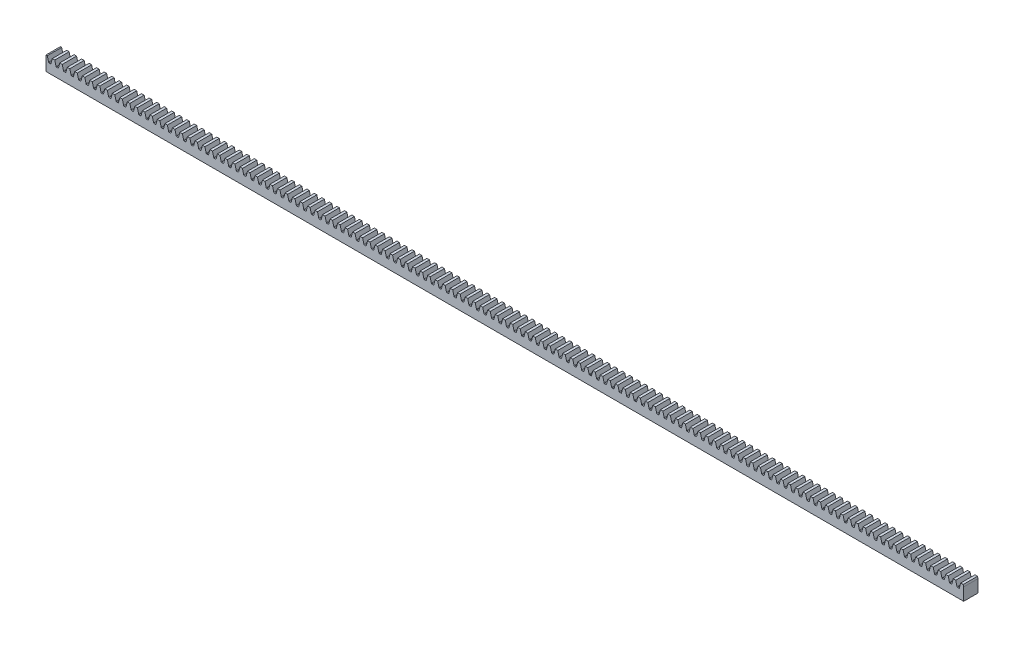
from build123d import *

# Parameters (mm, degrees)
SKETCH1_W           = 304.8
SKETCH1_H           = 4.7625
BOSS_EXTRUDE1_DEPTH = 2.38125
CUT_EXTRUDE1_DEPTH  = 4.7625
FILLET3_R           = 0.181970114
LPATTERN4_START     = -2.38125
LPATTERN4_DEPTH     = 4.7625


# Read off the part's stored shape, not the designer's step: LPattern4
with BuildPart() as part:
    # Sketch1 → Boss-Extrude1 (new, symmetric)
    with BuildSketch(Plane.XY):
        Rectangle(SKETCH1_W, SKETCH1_H)
    extrude(amount=BOSS_EXTRUDE1_DEPTH, both=True)

    # Sketch2 → Cut-Extrude1 (cut)
    with BuildSketch(Plane.XY.offset(2.38125)):
        Polygon((-151.981866458, 2.38125), (-151.517117728, 0.5842), (-150.789237272, 0.5842), (-150.324488542, 2.38125), align=None)
    extrude(amount=-CUT_EXTRUDE1_DEPTH, mode=Mode.SUBTRACT)

    # Fillet3
    fillet3_edges = [part.edges().sort_by_distance(p)[0] for p in [
        (-150.789237272, 0.5842, 0),
        (-151.517117728, 0.5842, 0),
    ]]
    fillet(fillet3_edges, radius=FILLET3_R)

    # LPattern4 outline → LPattern4 (cut)
    with BuildSketch(Plane.XY.offset(LPATTERN4_START)):
        with BuildLine():
            ThreePointArc((-149.058750348, 0.720608436), (-148.99398166, 0.622288242), (-148.882576412, 0.5842))
            Line((-148.882576412, 0.5842), (-148.436488588, 0.5842))
            ThreePointArc((-148.436488588, 0.5842), (-148.32508334, 0.622288242), (-148.260314652, 0.720608436))
            Line((-148.260314652, 0.720608436), (-147.830843542, 2.38125))
            Line((-147.830843542, 2.38125), (-149.488221458, 2.38125))
            Line((-149.488221458, 2.38125), (-149.058750348, 0.720608436))
        make_face()
        Polygon((152.4, 2.38125), (152.242823542, 2.38125), (152.4, 1.773493733), align=None)
        with BuildLine():
            Line((151.406556458, 2.38125), (149.749178542, 2.38125))
            Line((149.749178542, 2.38125), (150.178649652, 0.720608436))
            ThreePointArc((150.178649652, 0.720608436), (150.24341834, 0.622288242), (150.354823588, 0.5842))
            Line((150.354823588, 0.5842), (150.800911412, 0.5842))
            ThreePointArc((150.800911412, 0.5842), (150.91231666, 0.622288242), (150.977085348, 0.720608436))
            Line((150.977085348, 0.720608436), (151.406556458, 2.38125))
        make_face()
        with BuildLine():
            Line((148.912911458, 2.38125), (147.255533542, 2.38125))
            Line((147.255533542, 2.38125), (147.685004652, 0.720608436))
            ThreePointArc((147.685004652, 0.720608436), (147.74977334, 0.622288242), (147.861178588, 0.5842))
            Line((147.861178588, 0.5842), (148.307266412, 0.5842))
            ThreePointArc((148.307266412, 0.5842), (148.41867166, 0.622288242), (148.483440348, 0.720608436))
            Line((148.483440348, 0.720608436), (148.912911458, 2.38125))
        make_face()
        with BuildLine():
            Line((146.419266458, 2.38125), (144.761888542, 2.38125))
            Line((144.761888542, 2.38125), (145.191359652, 0.720608436))
            ThreePointArc((145.191359652, 0.720608436), (145.25612834, 0.622288242), (145.367533588, 0.5842))
            Line((145.367533588, 0.5842), (145.813621412, 0.5842))
            ThreePointArc((145.813621412, 0.5842), (145.92502666, 0.622288242), (145.989795348, 0.720608436))
            Line((145.989795348, 0.720608436), (146.419266458, 2.38125))
        make_face()
        with BuildLine():
            Line((143.925621458, 2.38125), (142.268243542, 2.38125))
            Line((142.268243542, 2.38125), (142.697714652, 0.720608436))
            ThreePointArc((142.697714652, 0.720608436), (142.76248334, 0.622288242), (142.873888588, 0.5842))
            Line((142.873888588, 0.5842), (143.319976412, 0.5842))
            ThreePointArc((143.319976412, 0.5842), (143.43138166, 0.622288242), (143.496150348, 0.720608436))
            Line((143.496150348, 0.720608436), (143.925621458, 2.38125))
        make_face()
        with BuildLine():
            Line((141.431976458, 2.38125), (139.774598542, 2.38125))
            Line((139.774598542, 2.38125), (140.204069652, 0.720608436))
            ThreePointArc((140.204069652, 0.720608436), (140.26883834, 0.622288242), (140.380243588, 0.5842))
            Line((140.380243588, 0.5842), (140.826331412, 0.5842))
            ThreePointArc((140.826331412, 0.5842), (140.93773666, 0.622288242), (141.002505348, 0.720608436))
            Line((141.002505348, 0.720608436), (141.431976458, 2.38125))
        make_face()
        with BuildLine():
            Line((138.938331458, 2.38125), (137.280953542, 2.38125))
            Line((137.280953542, 2.38125), (137.710424652, 0.720608436))
            ThreePointArc((137.710424652, 0.720608436), (137.77519334, 0.622288242), (137.886598588, 0.5842))
            Line((137.886598588, 0.5842), (138.332686412, 0.5842))
            ThreePointArc((138.332686412, 0.5842), (138.44409166, 0.622288242), (138.508860348, 0.720608436))
            Line((138.508860348, 0.720608436), (138.938331458, 2.38125))
        make_face()
        with BuildLine():
            Line((136.444686458, 2.38125), (134.787308542, 2.38125))
            Line((134.787308542, 2.38125), (135.216779652, 0.720608436))
            ThreePointArc((135.216779652, 0.720608436), (135.28154834, 0.622288242), (135.392953588, 0.5842))
            Line((135.392953588, 0.5842), (135.839041412, 0.5842))
            ThreePointArc((135.839041412, 0.5842), (135.95044666, 0.622288242), (136.015215348, 0.720608436))
            Line((136.015215348, 0.720608436), (136.444686458, 2.38125))
        make_face()
        with BuildLine():
            Line((133.951041458, 2.38125), (132.293663542, 2.38125))
            Line((132.293663542, 2.38125), (132.723134652, 0.720608436))
            ThreePointArc((132.723134652, 0.720608436), (132.78790334, 0.622288242), (132.899308588, 0.5842))
            Line((132.899308588, 0.5842), (133.345396412, 0.5842))
            ThreePointArc((133.345396412, 0.5842), (133.45680166, 0.622288242), (133.521570348, 0.720608436))
            Line((133.521570348, 0.720608436), (133.951041458, 2.38125))
        make_face()
        with BuildLine():
            Line((131.457396458, 2.38125), (129.800018542, 2.38125))
            Line((129.800018542, 2.38125), (130.229489652, 0.720608436))
            ThreePointArc((130.229489652, 0.720608436), (130.29425834, 0.622288242), (130.405663588, 0.5842))
            Line((130.405663588, 0.5842), (130.851751412, 0.5842))
            ThreePointArc((130.851751412, 0.5842), (130.96315666, 0.622288242), (131.027925348, 0.720608436))
            Line((131.027925348, 0.720608436), (131.457396458, 2.38125))
        make_face()
        with BuildLine():
            Line((128.963751458, 2.38125), (127.306373542, 2.38125))
            Line((127.306373542, 2.38125), (127.735844652, 0.720608436))
            ThreePointArc((127.735844652, 0.720608436), (127.80061334, 0.622288242), (127.912018588, 0.5842))
            Line((127.912018588, 0.5842), (128.358106412, 0.5842))
            ThreePointArc((128.358106412, 0.5842), (128.46951166, 0.622288242), (128.534280348, 0.720608436))
            Line((128.534280348, 0.720608436), (128.963751458, 2.38125))
        make_face()
        with BuildLine():
            Line((126.470106458, 2.38125), (124.812728542, 2.38125))
            Line((124.812728542, 2.38125), (125.242199652, 0.720608436))
            ThreePointArc((125.242199652, 0.720608436), (125.30696834, 0.622288242), (125.418373588, 0.5842))
            Line((125.418373588, 0.5842), (125.864461412, 0.5842))
            ThreePointArc((125.864461412, 0.5842), (125.97586666, 0.622288242), (126.040635348, 0.720608436))
            Line((126.040635348, 0.720608436), (126.470106458, 2.38125))
        make_face()
        with BuildLine():
            Line((123.976461458, 2.38125), (122.319083542, 2.38125))
            Line((122.319083542, 2.38125), (122.748554652, 0.720608436))
            ThreePointArc((122.748554652, 0.720608436), (122.81332334, 0.622288242), (122.924728588, 0.5842))
            Line((122.924728588, 0.5842), (123.370816412, 0.5842))
            ThreePointArc((123.370816412, 0.5842), (123.48222166, 0.622288242), (123.546990348, 0.720608436))
            Line((123.546990348, 0.720608436), (123.976461458, 2.38125))
        make_face()
        with BuildLine():
            Line((121.482816458, 2.38125), (119.825438542, 2.38125))
            Line((119.825438542, 2.38125), (120.254909652, 0.720608436))
            ThreePointArc((120.254909652, 0.720608436), (120.31967834, 0.622288242), (120.431083588, 0.5842))
            Line((120.431083588, 0.5842), (120.877171412, 0.5842))
            ThreePointArc((120.877171412, 0.5842), (120.98857666, 0.622288242), (121.053345348, 0.720608436))
            Line((121.053345348, 0.720608436), (121.482816458, 2.38125))
        make_face()
        with BuildLine():
            Line((118.989171458, 2.38125), (117.331793542, 2.38125))
            Line((117.331793542, 2.38125), (117.761264652, 0.720608436))
            ThreePointArc((117.761264652, 0.720608436), (117.82603334, 0.622288242), (117.937438588, 0.5842))
            Line((117.937438588, 0.5842), (118.383526412, 0.5842))
            ThreePointArc((118.383526412, 0.5842), (118.49493166, 0.622288242), (118.559700348, 0.720608436))
            Line((118.559700348, 0.720608436), (118.989171458, 2.38125))
        make_face()
        with BuildLine():
            Line((116.495526458, 2.38125), (114.838148542, 2.38125))
            Line((114.838148542, 2.38125), (115.267619652, 0.720608436))
            ThreePointArc((115.267619652, 0.720608436), (115.33238834, 0.622288242), (115.443793588, 0.5842))
            Line((115.443793588, 0.5842), (115.889881412, 0.5842))
            ThreePointArc((115.889881412, 0.5842), (116.00128666, 0.622288242), (116.066055348, 0.720608436))
            Line((116.066055348, 0.720608436), (116.495526458, 2.38125))
        make_face()
        with BuildLine():
            Line((114.001881458, 2.38125), (112.344503542, 2.38125))
            Line((112.344503542, 2.38125), (112.773974652, 0.720608436))
            ThreePointArc((112.773974652, 0.720608436), (112.83874334, 0.622288242), (112.950148588, 0.5842))
            Line((112.950148588, 0.5842), (113.396236412, 0.5842))
            ThreePointArc((113.396236412, 0.5842), (113.50764166, 0.622288242), (113.572410348, 0.720608436))
            Line((113.572410348, 0.720608436), (114.001881458, 2.38125))
        make_face()
        with BuildLine():
            Line((111.508236458, 2.38125), (109.850858542, 2.38125))
            Line((109.850858542, 2.38125), (110.280329652, 0.720608436))
            ThreePointArc((110.280329652, 0.720608436), (110.34509834, 0.622288242), (110.456503588, 0.5842))
            Line((110.456503588, 0.5842), (110.902591412, 0.5842))
            ThreePointArc((110.902591412, 0.5842), (111.01399666, 0.622288242), (111.078765348, 0.720608436))
            Line((111.078765348, 0.720608436), (111.508236458, 2.38125))
        make_face()
        with BuildLine():
            Line((109.014591458, 2.38125), (107.357213542, 2.38125))
            Line((107.357213542, 2.38125), (107.786684652, 0.720608436))
            ThreePointArc((107.786684652, 0.720608436), (107.85145334, 0.622288242), (107.962858588, 0.5842))
            Line((107.962858588, 0.5842), (108.408946412, 0.5842))
            ThreePointArc((108.408946412, 0.5842), (108.52035166, 0.622288242), (108.585120348, 0.720608436))
            Line((108.585120348, 0.720608436), (109.014591458, 2.38125))
        make_face()
        with BuildLine():
            Line((106.520946458, 2.38125), (104.863568542, 2.38125))
            Line((104.863568542, 2.38125), (105.293039652, 0.720608436))
            ThreePointArc((105.293039652, 0.720608436), (105.35780834, 0.622288242), (105.469213588, 0.5842))
            Line((105.469213588, 0.5842), (105.915301412, 0.5842))
            ThreePointArc((105.915301412, 0.5842), (106.02670666, 0.622288242), (106.091475348, 0.720608436))
            Line((106.091475348, 0.720608436), (106.520946458, 2.38125))
        make_face()
        with BuildLine():
            Line((104.027301458, 2.38125), (102.369923542, 2.38125))
            Line((102.369923542, 2.38125), (102.799394652, 0.720608436))
            ThreePointArc((102.799394652, 0.720608436), (102.86416334, 0.622288242), (102.975568588, 0.5842))
            Line((102.975568588, 0.5842), (103.421656412, 0.5842))
            ThreePointArc((103.421656412, 0.5842), (103.53306166, 0.622288242), (103.597830348, 0.720608436))
            Line((103.597830348, 0.720608436), (104.027301458, 2.38125))
        make_face()
        with BuildLine():
            Line((101.533656458, 2.38125), (99.876278542, 2.38125))
            Line((99.876278542, 2.38125), (100.305749652, 0.720608436))
            ThreePointArc((100.305749652, 0.720608436), (100.37051834, 0.622288242), (100.481923588, 0.5842))
            Line((100.481923588, 0.5842), (100.928011412, 0.5842))
            ThreePointArc((100.928011412, 0.5842), (101.03941666, 0.622288242), (101.104185348, 0.720608436))
            Line((101.104185348, 0.720608436), (101.533656458, 2.38125))
        make_face()
        with BuildLine():
            Line((99.040011458, 2.38125), (97.382633542, 2.38125))
            Line((97.382633542, 2.38125), (97.812104652, 0.720608436))
            ThreePointArc((97.812104652, 0.720608436), (97.87687334, 0.622288242), (97.988278588, 0.5842))
            Line((97.988278588, 0.5842), (98.434366412, 0.5842))
            ThreePointArc((98.434366412, 0.5842), (98.54577166, 0.622288242), (98.610540348, 0.720608436))
            Line((98.610540348, 0.720608436), (99.040011458, 2.38125))
        make_face()
        with BuildLine():
            Line((96.546366458, 2.38125), (94.888988542, 2.38125))
            Line((94.888988542, 2.38125), (95.318459652, 0.720608436))
            ThreePointArc((95.318459652, 0.720608436), (95.38322834, 0.622288242), (95.494633588, 0.5842))
            Line((95.494633588, 0.5842), (95.940721412, 0.5842))
            ThreePointArc((95.940721412, 0.5842), (96.05212666, 0.622288242), (96.116895348, 0.720608436))
            Line((96.116895348, 0.720608436), (96.546366458, 2.38125))
        make_face()
        with BuildLine():
            Line((94.052721458, 2.38125), (92.395343542, 2.38125))
            Line((92.395343542, 2.38125), (92.824814652, 0.720608436))
            ThreePointArc((92.824814652, 0.720608436), (92.88958334, 0.622288242), (93.000988588, 0.5842))
            Line((93.000988588, 0.5842), (93.447076412, 0.5842))
            ThreePointArc((93.447076412, 0.5842), (93.55848166, 0.622288242), (93.623250348, 0.720608436))
            Line((93.623250348, 0.720608436), (94.052721458, 2.38125))
        make_face()
        with BuildLine():
            Line((91.559076458, 2.38125), (89.901698542, 2.38125))
            Line((89.901698542, 2.38125), (90.331169652, 0.720608436))
            ThreePointArc((90.331169652, 0.720608436), (90.39593834, 0.622288242), (90.507343588, 0.5842))
            Line((90.507343588, 0.5842), (90.953431412, 0.5842))
            ThreePointArc((90.953431412, 0.5842), (91.06483666, 0.622288242), (91.129605348, 0.720608436))
            Line((91.129605348, 0.720608436), (91.559076458, 2.38125))
        make_face()
        with BuildLine():
            Line((89.065431458, 2.38125), (87.408053542, 2.38125))
            Line((87.408053542, 2.38125), (87.837524652, 0.720608436))
            ThreePointArc((87.837524652, 0.720608436), (87.90229334, 0.622288242), (88.013698588, 0.5842))
            Line((88.013698588, 0.5842), (88.459786412, 0.5842))
            ThreePointArc((88.459786412, 0.5842), (88.57119166, 0.622288242), (88.635960348, 0.720608436))
            Line((88.635960348, 0.720608436), (89.065431458, 2.38125))
        make_face()
        with BuildLine():
            Line((86.571786458, 2.38125), (84.914408542, 2.38125))
            Line((84.914408542, 2.38125), (85.343879652, 0.720608436))
            ThreePointArc((85.343879652, 0.720608436), (85.40864834, 0.622288242), (85.520053588, 0.5842))
            Line((85.520053588, 0.5842), (85.966141412, 0.5842))
            ThreePointArc((85.966141412, 0.5842), (86.07754666, 0.622288242), (86.142315348, 0.720608436))
            Line((86.142315348, 0.720608436), (86.571786458, 2.38125))
        make_face()
        with BuildLine():
            Line((84.078141458, 2.38125), (82.420763542, 2.38125))
            Line((82.420763542, 2.38125), (82.850234652, 0.720608436))
            ThreePointArc((82.850234652, 0.720608436), (82.91500334, 0.622288242), (83.026408588, 0.5842))
            Line((83.026408588, 0.5842), (83.472496412, 0.5842))
            ThreePointArc((83.472496412, 0.5842), (83.58390166, 0.622288242), (83.648670348, 0.720608436))
            Line((83.648670348, 0.720608436), (84.078141458, 2.38125))
        make_face()
        with BuildLine():
            Line((81.584496458, 2.38125), (79.927118542, 2.38125))
            Line((79.927118542, 2.38125), (80.356589652, 0.720608436))
            ThreePointArc((80.356589652, 0.720608436), (80.42135834, 0.622288242), (80.532763588, 0.5842))
            Line((80.532763588, 0.5842), (80.978851412, 0.5842))
            ThreePointArc((80.978851412, 0.5842), (81.09025666, 0.622288242), (81.155025348, 0.720608436))
            Line((81.155025348, 0.720608436), (81.584496458, 2.38125))
        make_face()
        with BuildLine():
            Line((79.090851458, 2.38125), (77.433473542, 2.38125))
            Line((77.433473542, 2.38125), (77.862944652, 0.720608436))
            ThreePointArc((77.862944652, 0.720608436), (77.92771334, 0.622288242), (78.039118588, 0.5842))
            Line((78.039118588, 0.5842), (78.485206412, 0.5842))
            ThreePointArc((78.485206412, 0.5842), (78.59661166, 0.622288242), (78.661380348, 0.720608436))
            Line((78.661380348, 0.720608436), (79.090851458, 2.38125))
        make_face()
        with BuildLine():
            Line((76.597206458, 2.38125), (74.939828542, 2.38125))
            Line((74.939828542, 2.38125), (75.369299652, 0.720608436))
            ThreePointArc((75.369299652, 0.720608436), (75.43406834, 0.622288242), (75.545473588, 0.5842))
            Line((75.545473588, 0.5842), (75.991561412, 0.5842))
            ThreePointArc((75.991561412, 0.5842), (76.10296666, 0.622288242), (76.167735348, 0.720608436))
            Line((76.167735348, 0.720608436), (76.597206458, 2.38125))
        make_face()
        with BuildLine():
            Line((74.103561458, 2.38125), (72.446183542, 2.38125))
            Line((72.446183542, 2.38125), (72.875654652, 0.720608436))
            ThreePointArc((72.875654652, 0.720608436), (72.94042334, 0.622288242), (73.051828588, 0.5842))
            Line((73.051828588, 0.5842), (73.497916412, 0.5842))
            ThreePointArc((73.497916412, 0.5842), (73.60932166, 0.622288242), (73.674090348, 0.720608436))
            Line((73.674090348, 0.720608436), (74.103561458, 2.38125))
        make_face()
        with BuildLine():
            Line((71.609916458, 2.38125), (69.952538542, 2.38125))
            Line((69.952538542, 2.38125), (70.382009652, 0.720608436))
            ThreePointArc((70.382009652, 0.720608436), (70.44677834, 0.622288242), (70.558183588, 0.5842))
            Line((70.558183588, 0.5842), (71.004271412, 0.5842))
            ThreePointArc((71.004271412, 0.5842), (71.11567666, 0.622288242), (71.180445348, 0.720608436))
            Line((71.180445348, 0.720608436), (71.609916458, 2.38125))
        make_face()
        with BuildLine():
            Line((69.116271458, 2.38125), (67.458893542, 2.38125))
            Line((67.458893542, 2.38125), (67.888364652, 0.720608436))
            ThreePointArc((67.888364652, 0.720608436), (67.95313334, 0.622288242), (68.064538588, 0.5842))
            Line((68.064538588, 0.5842), (68.510626412, 0.5842))
            ThreePointArc((68.510626412, 0.5842), (68.62203166, 0.622288242), (68.686800348, 0.720608436))
            Line((68.686800348, 0.720608436), (69.116271458, 2.38125))
        make_face()
        with BuildLine():
            Line((66.622626458, 2.38125), (64.965248542, 2.38125))
            Line((64.965248542, 2.38125), (65.394719652, 0.720608436))
            ThreePointArc((65.394719652, 0.720608436), (65.45948834, 0.622288242), (65.570893588, 0.5842))
            Line((65.570893588, 0.5842), (66.016981412, 0.5842))
            ThreePointArc((66.016981412, 0.5842), (66.12838666, 0.622288242), (66.193155348, 0.720608436))
            Line((66.193155348, 0.720608436), (66.622626458, 2.38125))
        make_face()
        with BuildLine():
            Line((64.128981458, 2.38125), (62.471603542, 2.38125))
            Line((62.471603542, 2.38125), (62.901074652, 0.720608436))
            ThreePointArc((62.901074652, 0.720608436), (62.96584334, 0.622288242), (63.077248588, 0.5842))
            Line((63.077248588, 0.5842), (63.523336412, 0.5842))
            ThreePointArc((63.523336412, 0.5842), (63.63474166, 0.622288242), (63.699510348, 0.720608436))
            Line((63.699510348, 0.720608436), (64.128981458, 2.38125))
        make_face()
        with BuildLine():
            Line((61.635336458, 2.38125), (59.977958542, 2.38125))
            Line((59.977958542, 2.38125), (60.407429652, 0.720608436))
            ThreePointArc((60.407429652, 0.720608436), (60.47219834, 0.622288242), (60.583603588, 0.5842))
            Line((60.583603588, 0.5842), (61.029691412, 0.5842))
            ThreePointArc((61.029691412, 0.5842), (61.14109666, 0.622288242), (61.205865348, 0.720608436))
            Line((61.205865348, 0.720608436), (61.635336458, 2.38125))
        make_face()
        with BuildLine():
            Line((59.141691458, 2.38125), (57.484313542, 2.38125))
            Line((57.484313542, 2.38125), (57.913784652, 0.720608436))
            ThreePointArc((57.913784652, 0.720608436), (57.97855334, 0.622288242), (58.089958588, 0.5842))
            Line((58.089958588, 0.5842), (58.536046412, 0.5842))
            ThreePointArc((58.536046412, 0.5842), (58.64745166, 0.622288242), (58.712220348, 0.720608436))
            Line((58.712220348, 0.720608436), (59.141691458, 2.38125))
        make_face()
        with BuildLine():
            Line((56.648046458, 2.38125), (54.990668542, 2.38125))
            Line((54.990668542, 2.38125), (55.420139652, 0.720608436))
            ThreePointArc((55.420139652, 0.720608436), (55.48490834, 0.622288242), (55.596313588, 0.5842))
            Line((55.596313588, 0.5842), (56.042401412, 0.5842))
            ThreePointArc((56.042401412, 0.5842), (56.15380666, 0.622288242), (56.218575348, 0.720608436))
            Line((56.218575348, 0.720608436), (56.648046458, 2.38125))
        make_face()
        with BuildLine():
            Line((54.154401458, 2.38125), (52.497023542, 2.38125))
            Line((52.497023542, 2.38125), (52.926494652, 0.720608436))
            ThreePointArc((52.926494652, 0.720608436), (52.99126334, 0.622288242), (53.102668588, 0.5842))
            Line((53.102668588, 0.5842), (53.548756412, 0.5842))
            ThreePointArc((53.548756412, 0.5842), (53.66016166, 0.622288242), (53.724930348, 0.720608436))
            Line((53.724930348, 0.720608436), (54.154401458, 2.38125))
        make_face()
        with BuildLine():
            Line((51.660756458, 2.38125), (50.003378542, 2.38125))
            Line((50.003378542, 2.38125), (50.432849652, 0.720608436))
            ThreePointArc((50.432849652, 0.720608436), (50.49761834, 0.622288242), (50.609023588, 0.5842))
            Line((50.609023588, 0.5842), (51.055111412, 0.5842))
            ThreePointArc((51.055111412, 0.5842), (51.16651666, 0.622288242), (51.231285348, 0.720608436))
            Line((51.231285348, 0.720608436), (51.660756458, 2.38125))
        make_face()
        with BuildLine():
            Line((49.167111458, 2.38125), (47.509733542, 2.38125))
            Line((47.509733542, 2.38125), (47.939204652, 0.720608436))
            ThreePointArc((47.939204652, 0.720608436), (48.00397334, 0.622288242), (48.115378588, 0.5842))
            Line((48.115378588, 0.5842), (48.561466412, 0.5842))
            ThreePointArc((48.561466412, 0.5842), (48.67287166, 0.622288242), (48.737640348, 0.720608436))
            Line((48.737640348, 0.720608436), (49.167111458, 2.38125))
        make_face()
        with BuildLine():
            Line((46.673466458, 2.38125), (45.016088542, 2.38125))
            Line((45.016088542, 2.38125), (45.445559652, 0.720608436))
            ThreePointArc((45.445559652, 0.720608436), (45.51032834, 0.622288242), (45.621733588, 0.5842))
            Line((45.621733588, 0.5842), (46.067821412, 0.5842))
            ThreePointArc((46.067821412, 0.5842), (46.17922666, 0.622288242), (46.243995348, 0.720608436))
            Line((46.243995348, 0.720608436), (46.673466458, 2.38125))
        make_face()
        with BuildLine():
            Line((44.179821458, 2.38125), (42.522443542, 2.38125))
            Line((42.522443542, 2.38125), (42.951914652, 0.720608436))
            ThreePointArc((42.951914652, 0.720608436), (43.01668334, 0.622288242), (43.128088588, 0.5842))
            Line((43.128088588, 0.5842), (43.574176412, 0.5842))
            ThreePointArc((43.574176412, 0.5842), (43.68558166, 0.622288242), (43.750350348, 0.720608436))
            Line((43.750350348, 0.720608436), (44.179821458, 2.38125))
        make_face()
        with BuildLine():
            Line((41.686176458, 2.38125), (40.028798542, 2.38125))
            Line((40.028798542, 2.38125), (40.458269652, 0.720608436))
            ThreePointArc((40.458269652, 0.720608436), (40.52303834, 0.622288242), (40.634443588, 0.5842))
            Line((40.634443588, 0.5842), (41.080531412, 0.5842))
            ThreePointArc((41.080531412, 0.5842), (41.19193666, 0.622288242), (41.256705348, 0.720608436))
            Line((41.256705348, 0.720608436), (41.686176458, 2.38125))
        make_face()
        with BuildLine():
            Line((39.192531458, 2.38125), (37.535153542, 2.38125))
            Line((37.535153542, 2.38125), (37.964624652, 0.720608436))
            ThreePointArc((37.964624652, 0.720608436), (38.02939334, 0.622288242), (38.140798588, 0.5842))
            Line((38.140798588, 0.5842), (38.586886412, 0.5842))
            ThreePointArc((38.586886412, 0.5842), (38.69829166, 0.622288242), (38.763060348, 0.720608436))
            Line((38.763060348, 0.720608436), (39.192531458, 2.38125))
        make_face()
        with BuildLine():
            Line((36.698886458, 2.38125), (35.041508542, 2.38125))
            Line((35.041508542, 2.38125), (35.470979652, 0.720608436))
            ThreePointArc((35.470979652, 0.720608436), (35.53574834, 0.622288242), (35.647153588, 0.5842))
            Line((35.647153588, 0.5842), (36.093241412, 0.5842))
            ThreePointArc((36.093241412, 0.5842), (36.20464666, 0.622288242), (36.269415348, 0.720608436))
            Line((36.269415348, 0.720608436), (36.698886458, 2.38125))
        make_face()
        with BuildLine():
            Line((34.205241458, 2.38125), (32.547863542, 2.38125))
            Line((32.547863542, 2.38125), (32.977334652, 0.720608436))
            ThreePointArc((32.977334652, 0.720608436), (33.04210334, 0.622288242), (33.153508588, 0.5842))
            Line((33.153508588, 0.5842), (33.599596412, 0.5842))
            ThreePointArc((33.599596412, 0.5842), (33.71100166, 0.622288242), (33.775770348, 0.720608436))
            Line((33.775770348, 0.720608436), (34.205241458, 2.38125))
        make_face()
        with BuildLine():
            Line((31.711596458, 2.38125), (30.054218542, 2.38125))
            Line((30.054218542, 2.38125), (30.483689652, 0.720608436))
            ThreePointArc((30.483689652, 0.720608436), (30.54845834, 0.622288242), (30.659863588, 0.5842))
            Line((30.659863588, 0.5842), (31.105951412, 0.5842))
            ThreePointArc((31.105951412, 0.5842), (31.21735666, 0.622288242), (31.282125348, 0.720608436))
            Line((31.282125348, 0.720608436), (31.711596458, 2.38125))
        make_face()
        with BuildLine():
            Line((29.217951458, 2.38125), (27.560573542, 2.38125))
            Line((27.560573542, 2.38125), (27.990044652, 0.720608436))
            ThreePointArc((27.990044652, 0.720608436), (28.05481334, 0.622288242), (28.166218588, 0.5842))
            Line((28.166218588, 0.5842), (28.612306412, 0.5842))
            ThreePointArc((28.612306412, 0.5842), (28.72371166, 0.622288242), (28.788480348, 0.720608436))
            Line((28.788480348, 0.720608436), (29.217951458, 2.38125))
        make_face()
        with BuildLine():
            Line((26.724306458, 2.38125), (25.066928542, 2.38125))
            Line((25.066928542, 2.38125), (25.496399652, 0.720608436))
            ThreePointArc((25.496399652, 0.720608436), (25.56116834, 0.622288242), (25.672573588, 0.5842))
            Line((25.672573588, 0.5842), (26.118661412, 0.5842))
            ThreePointArc((26.118661412, 0.5842), (26.23006666, 0.622288242), (26.294835348, 0.720608436))
            Line((26.294835348, 0.720608436), (26.724306458, 2.38125))
        make_face()
        with BuildLine():
            Line((24.230661458, 2.38125), (22.573283542, 2.38125))
            Line((22.573283542, 2.38125), (23.002754652, 0.720608436))
            ThreePointArc((23.002754652, 0.720608436), (23.06752334, 0.622288242), (23.178928588, 0.5842))
            Line((23.178928588, 0.5842), (23.625016412, 0.5842))
            ThreePointArc((23.625016412, 0.5842), (23.73642166, 0.622288242), (23.801190348, 0.720608436))
            Line((23.801190348, 0.720608436), (24.230661458, 2.38125))
        make_face()
        with BuildLine():
            Line((21.737016458, 2.38125), (20.079638542, 2.38125))
            Line((20.079638542, 2.38125), (20.509109652, 0.720608436))
            ThreePointArc((20.509109652, 0.720608436), (20.57387834, 0.622288242), (20.685283588, 0.5842))
            Line((20.685283588, 0.5842), (21.131371412, 0.5842))
            ThreePointArc((21.131371412, 0.5842), (21.24277666, 0.622288242), (21.307545348, 0.720608436))
            Line((21.307545348, 0.720608436), (21.737016458, 2.38125))
        make_face()
        with BuildLine():
            Line((19.243371458, 2.38125), (17.585993542, 2.38125))
            Line((17.585993542, 2.38125), (18.015464652, 0.720608436))
            ThreePointArc((18.015464652, 0.720608436), (18.08023334, 0.622288242), (18.191638588, 0.5842))
            Line((18.191638588, 0.5842), (18.637726412, 0.5842))
            ThreePointArc((18.637726412, 0.5842), (18.74913166, 0.622288242), (18.813900348, 0.720608436))
            Line((18.813900348, 0.720608436), (19.243371458, 2.38125))
        make_face()
        with BuildLine():
            Line((16.749726458, 2.38125), (15.092348542, 2.38125))
            Line((15.092348542, 2.38125), (15.521819652, 0.720608436))
            ThreePointArc((15.521819652, 0.720608436), (15.58658834, 0.622288242), (15.697993588, 0.5842))
            Line((15.697993588, 0.5842), (16.144081412, 0.5842))
            ThreePointArc((16.144081412, 0.5842), (16.25548666, 0.622288242), (16.320255348, 0.720608436))
            Line((16.320255348, 0.720608436), (16.749726458, 2.38125))
        make_face()
        with BuildLine():
            Line((14.256081458, 2.38125), (12.598703542, 2.38125))
            Line((12.598703542, 2.38125), (13.028174652, 0.720608436))
            ThreePointArc((13.028174652, 0.720608436), (13.09294334, 0.622288242), (13.204348588, 0.5842))
            Line((13.204348588, 0.5842), (13.650436412, 0.5842))
            ThreePointArc((13.650436412, 0.5842), (13.76184166, 0.622288242), (13.826610348, 0.720608436))
            Line((13.826610348, 0.720608436), (14.256081458, 2.38125))
        make_face()
        with BuildLine():
            Line((11.762436458, 2.38125), (10.105058542, 2.38125))
            Line((10.105058542, 2.38125), (10.534529652, 0.720608436))
            ThreePointArc((10.534529652, 0.720608436), (10.59929834, 0.622288242), (10.710703588, 0.5842))
            Line((10.710703588, 0.5842), (11.156791412, 0.5842))
            ThreePointArc((11.156791412, 0.5842), (11.26819666, 0.622288242), (11.332965348, 0.720608436))
            Line((11.332965348, 0.720608436), (11.762436458, 2.38125))
        make_face()
        with BuildLine():
            Line((9.268791458, 2.38125), (7.611413542, 2.38125))
            Line((7.611413542, 2.38125), (8.040884652, 0.720608436))
            ThreePointArc((8.040884652, 0.720608436), (8.10565334, 0.622288242), (8.217058588, 0.5842))
            Line((8.217058588, 0.5842), (8.663146412, 0.5842))
            ThreePointArc((8.663146412, 0.5842), (8.77455166, 0.622288242), (8.839320348, 0.720608436))
            Line((8.839320348, 0.720608436), (9.268791458, 2.38125))
        make_face()
        with BuildLine():
            Line((6.775146458, 2.38125), (5.117768542, 2.38125))
            Line((5.117768542, 2.38125), (5.547239652, 0.720608436))
            ThreePointArc((5.547239652, 0.720608436), (5.61200834, 0.622288242), (5.723413588, 0.5842))
            Line((5.723413588, 0.5842), (6.169501412, 0.5842))
            ThreePointArc((6.169501412, 0.5842), (6.28090666, 0.622288242), (6.345675348, 0.720608436))
            Line((6.345675348, 0.720608436), (6.775146458, 2.38125))
        make_face()
        with BuildLine():
            Line((4.281501458, 2.38125), (2.624123542, 2.38125))
            Line((2.624123542, 2.38125), (3.053594652, 0.720608436))
            ThreePointArc((3.053594652, 0.720608436), (3.11836334, 0.622288242), (3.229768588, 0.5842))
            Line((3.229768588, 0.5842), (3.675856412, 0.5842))
            ThreePointArc((3.675856412, 0.5842), (3.78726166, 0.622288242), (3.852030348, 0.720608436))
            Line((3.852030348, 0.720608436), (4.281501458, 2.38125))
        make_face()
        with BuildLine():
            Line((1.787856458, 2.38125), (0.130478542, 2.38125))
            Line((0.130478542, 2.38125), (0.559949652, 0.720608436))
            ThreePointArc((0.559949652, 0.720608436), (0.62471834, 0.622288242), (0.736123588, 0.5842))
            Line((0.736123588, 0.5842), (1.182211412, 0.5842))
            ThreePointArc((1.182211412, 0.5842), (1.29361666, 0.622288242), (1.358385348, 0.720608436))
            Line((1.358385348, 0.720608436), (1.787856458, 2.38125))
        make_face()
        with BuildLine():
            Line((-0.705788542, 2.38125), (-2.363166458, 2.38125))
            Line((-2.363166458, 2.38125), (-1.933695348, 0.720608436))
            ThreePointArc((-1.933695348, 0.720608436), (-1.86892666, 0.622288242), (-1.757521412, 0.5842))
            Line((-1.757521412, 0.5842), (-1.311433588, 0.5842))
            ThreePointArc((-1.311433588, 0.5842), (-1.20002834, 0.622288242), (-1.135259652, 0.720608436))
            Line((-1.135259652, 0.720608436), (-0.705788542, 2.38125))
        make_face()
        with BuildLine():
            Line((-3.199433542, 2.38125), (-4.856811458, 2.38125))
            Line((-4.856811458, 2.38125), (-4.427340348, 0.720608436))
            ThreePointArc((-4.427340348, 0.720608436), (-4.36257166, 0.622288242), (-4.251166412, 0.5842))
            Line((-4.251166412, 0.5842), (-3.805078588, 0.5842))
            ThreePointArc((-3.805078588, 0.5842), (-3.69367334, 0.622288242), (-3.628904652, 0.720608436))
            Line((-3.628904652, 0.720608436), (-3.199433542, 2.38125))
        make_face()
        with BuildLine():
            Line((-5.693078542, 2.38125), (-7.350456458, 2.38125))
            Line((-7.350456458, 2.38125), (-6.920985348, 0.720608436))
            ThreePointArc((-6.920985348, 0.720608436), (-6.85621666, 0.622288242), (-6.744811412, 0.5842))
            Line((-6.744811412, 0.5842), (-6.298723588, 0.5842))
            ThreePointArc((-6.298723588, 0.5842), (-6.18731834, 0.622288242), (-6.122549652, 0.720608436))
            Line((-6.122549652, 0.720608436), (-5.693078542, 2.38125))
        make_face()
        with BuildLine():
            Line((-8.186723542, 2.38125), (-9.844101458, 2.38125))
            Line((-9.844101458, 2.38125), (-9.414630348, 0.720608436))
            ThreePointArc((-9.414630348, 0.720608436), (-9.34986166, 0.622288242), (-9.238456412, 0.5842))
            Line((-9.238456412, 0.5842), (-8.792368588, 0.5842))
            ThreePointArc((-8.792368588, 0.5842), (-8.68096334, 0.622288242), (-8.616194652, 0.720608436))
            Line((-8.616194652, 0.720608436), (-8.186723542, 2.38125))
        make_face()
        with BuildLine():
            Line((-10.680368542, 2.38125), (-12.337746458, 2.38125))
            Line((-12.337746458, 2.38125), (-11.908275348, 0.720608436))
            ThreePointArc((-11.908275348, 0.720608436), (-11.84350666, 0.622288242), (-11.732101412, 0.5842))
            Line((-11.732101412, 0.5842), (-11.286013588, 0.5842))
            ThreePointArc((-11.286013588, 0.5842), (-11.17460834, 0.622288242), (-11.109839652, 0.720608436))
            Line((-11.109839652, 0.720608436), (-10.680368542, 2.38125))
        make_face()
        with BuildLine():
            Line((-13.174013542, 2.38125), (-14.831391458, 2.38125))
            Line((-14.831391458, 2.38125), (-14.401920348, 0.720608436))
            ThreePointArc((-14.401920348, 0.720608436), (-14.33715166, 0.622288242), (-14.225746412, 0.5842))
            Line((-14.225746412, 0.5842), (-13.779658588, 0.5842))
            ThreePointArc((-13.779658588, 0.5842), (-13.66825334, 0.622288242), (-13.603484652, 0.720608436))
            Line((-13.603484652, 0.720608436), (-13.174013542, 2.38125))
        make_face()
        with BuildLine():
            Line((-15.667658542, 2.38125), (-17.325036458, 2.38125))
            Line((-17.325036458, 2.38125), (-16.895565348, 0.720608436))
            ThreePointArc((-16.895565348, 0.720608436), (-16.83079666, 0.622288242), (-16.719391412, 0.5842))
            Line((-16.719391412, 0.5842), (-16.273303588, 0.5842))
            ThreePointArc((-16.273303588, 0.5842), (-16.16189834, 0.622288242), (-16.097129652, 0.720608436))
            Line((-16.097129652, 0.720608436), (-15.667658542, 2.38125))
        make_face()
        with BuildLine():
            Line((-18.161303542, 2.38125), (-19.818681458, 2.38125))
            Line((-19.818681458, 2.38125), (-19.389210348, 0.720608436))
            ThreePointArc((-19.389210348, 0.720608436), (-19.32444166, 0.622288242), (-19.213036412, 0.5842))
            Line((-19.213036412, 0.5842), (-18.766948588, 0.5842))
            ThreePointArc((-18.766948588, 0.5842), (-18.65554334, 0.622288242), (-18.590774652, 0.720608436))
            Line((-18.590774652, 0.720608436), (-18.161303542, 2.38125))
        make_face()
        with BuildLine():
            Line((-20.654948542, 2.38125), (-22.312326458, 2.38125))
            Line((-22.312326458, 2.38125), (-21.882855348, 0.720608436))
            ThreePointArc((-21.882855348, 0.720608436), (-21.81808666, 0.622288242), (-21.706681412, 0.5842))
            Line((-21.706681412, 0.5842), (-21.260593588, 0.5842))
            ThreePointArc((-21.260593588, 0.5842), (-21.14918834, 0.622288242), (-21.084419652, 0.720608436))
            Line((-21.084419652, 0.720608436), (-20.654948542, 2.38125))
        make_face()
        with BuildLine():
            Line((-23.148593542, 2.38125), (-24.805971458, 2.38125))
            Line((-24.805971458, 2.38125), (-24.376500348, 0.720608436))
            ThreePointArc((-24.376500348, 0.720608436), (-24.31173166, 0.622288242), (-24.200326412, 0.5842))
            Line((-24.200326412, 0.5842), (-23.754238588, 0.5842))
            ThreePointArc((-23.754238588, 0.5842), (-23.64283334, 0.622288242), (-23.578064652, 0.720608436))
            Line((-23.578064652, 0.720608436), (-23.148593542, 2.38125))
        make_face()
        with BuildLine():
            Line((-25.642238542, 2.38125), (-27.299616458, 2.38125))
            Line((-27.299616458, 2.38125), (-26.870145348, 0.720608436))
            ThreePointArc((-26.870145348, 0.720608436), (-26.80537666, 0.622288242), (-26.693971412, 0.5842))
            Line((-26.693971412, 0.5842), (-26.247883588, 0.5842))
            ThreePointArc((-26.247883588, 0.5842), (-26.13647834, 0.622288242), (-26.071709652, 0.720608436))
            Line((-26.071709652, 0.720608436), (-25.642238542, 2.38125))
        make_face()
        with BuildLine():
            Line((-28.135883542, 2.38125), (-29.793261458, 2.38125))
            Line((-29.793261458, 2.38125), (-29.363790348, 0.720608436))
            ThreePointArc((-29.363790348, 0.720608436), (-29.29902166, 0.622288242), (-29.187616412, 0.5842))
            Line((-29.187616412, 0.5842), (-28.741528588, 0.5842))
            ThreePointArc((-28.741528588, 0.5842), (-28.63012334, 0.622288242), (-28.565354652, 0.720608436))
            Line((-28.565354652, 0.720608436), (-28.135883542, 2.38125))
        make_face()
        with BuildLine():
            Line((-30.629528542, 2.38125), (-32.286906458, 2.38125))
            Line((-32.286906458, 2.38125), (-31.857435348, 0.720608436))
            ThreePointArc((-31.857435348, 0.720608436), (-31.79266666, 0.622288242), (-31.681261412, 0.5842))
            Line((-31.681261412, 0.5842), (-31.235173588, 0.5842))
            ThreePointArc((-31.235173588, 0.5842), (-31.12376834, 0.622288242), (-31.058999652, 0.720608436))
            Line((-31.058999652, 0.720608436), (-30.629528542, 2.38125))
        make_face()
        with BuildLine():
            Line((-33.123173542, 2.38125), (-34.780551458, 2.38125))
            Line((-34.780551458, 2.38125), (-34.351080348, 0.720608436))
            ThreePointArc((-34.351080348, 0.720608436), (-34.28631166, 0.622288242), (-34.174906412, 0.5842))
            Line((-34.174906412, 0.5842), (-33.728818588, 0.5842))
            ThreePointArc((-33.728818588, 0.5842), (-33.61741334, 0.622288242), (-33.552644652, 0.720608436))
            Line((-33.552644652, 0.720608436), (-33.123173542, 2.38125))
        make_face()
        with BuildLine():
            Line((-35.616818542, 2.38125), (-37.274196458, 2.38125))
            Line((-37.274196458, 2.38125), (-36.844725348, 0.720608436))
            ThreePointArc((-36.844725348, 0.720608436), (-36.77995666, 0.622288242), (-36.668551412, 0.5842))
            Line((-36.668551412, 0.5842), (-36.222463588, 0.5842))
            ThreePointArc((-36.222463588, 0.5842), (-36.11105834, 0.622288242), (-36.046289652, 0.720608436))
            Line((-36.046289652, 0.720608436), (-35.616818542, 2.38125))
        make_face()
        with BuildLine():
            Line((-38.110463542, 2.38125), (-39.767841458, 2.38125))
            Line((-39.767841458, 2.38125), (-39.338370348, 0.720608436))
            ThreePointArc((-39.338370348, 0.720608436), (-39.27360166, 0.622288242), (-39.162196412, 0.5842))
            Line((-39.162196412, 0.5842), (-38.716108588, 0.5842))
            ThreePointArc((-38.716108588, 0.5842), (-38.60470334, 0.622288242), (-38.539934652, 0.720608436))
            Line((-38.539934652, 0.720608436), (-38.110463542, 2.38125))
        make_face()
        with BuildLine():
            Line((-40.604108542, 2.38125), (-42.261486458, 2.38125))
            Line((-42.261486458, 2.38125), (-41.832015348, 0.720608436))
            ThreePointArc((-41.832015348, 0.720608436), (-41.76724666, 0.622288242), (-41.655841412, 0.5842))
            Line((-41.655841412, 0.5842), (-41.209753588, 0.5842))
            ThreePointArc((-41.209753588, 0.5842), (-41.09834834, 0.622288242), (-41.033579652, 0.720608436))
            Line((-41.033579652, 0.720608436), (-40.604108542, 2.38125))
        make_face()
        with BuildLine():
            Line((-43.097753542, 2.38125), (-44.755131458, 2.38125))
            Line((-44.755131458, 2.38125), (-44.325660348, 0.720608436))
            ThreePointArc((-44.325660348, 0.720608436), (-44.26089166, 0.622288242), (-44.149486412, 0.5842))
            Line((-44.149486412, 0.5842), (-43.703398588, 0.5842))
            ThreePointArc((-43.703398588, 0.5842), (-43.59199334, 0.622288242), (-43.527224652, 0.720608436))
            Line((-43.527224652, 0.720608436), (-43.097753542, 2.38125))
        make_face()
        with BuildLine():
            Line((-45.591398542, 2.38125), (-47.248776458, 2.38125))
            Line((-47.248776458, 2.38125), (-46.819305348, 0.720608436))
            ThreePointArc((-46.819305348, 0.720608436), (-46.75453666, 0.622288242), (-46.643131412, 0.5842))
            Line((-46.643131412, 0.5842), (-46.197043588, 0.5842))
            ThreePointArc((-46.197043588, 0.5842), (-46.08563834, 0.622288242), (-46.020869652, 0.720608436))
            Line((-46.020869652, 0.720608436), (-45.591398542, 2.38125))
        make_face()
        with BuildLine():
            Line((-48.085043542, 2.38125), (-49.742421458, 2.38125))
            Line((-49.742421458, 2.38125), (-49.312950348, 0.720608436))
            ThreePointArc((-49.312950348, 0.720608436), (-49.24818166, 0.622288242), (-49.136776412, 0.5842))
            Line((-49.136776412, 0.5842), (-48.690688588, 0.5842))
            ThreePointArc((-48.690688588, 0.5842), (-48.57928334, 0.622288242), (-48.514514652, 0.720608436))
            Line((-48.514514652, 0.720608436), (-48.085043542, 2.38125))
        make_face()
        with BuildLine():
            Line((-50.578688542, 2.38125), (-52.236066458, 2.38125))
            Line((-52.236066458, 2.38125), (-51.806595348, 0.720608436))
            ThreePointArc((-51.806595348, 0.720608436), (-51.74182666, 0.622288242), (-51.630421412, 0.5842))
            Line((-51.630421412, 0.5842), (-51.184333588, 0.5842))
            ThreePointArc((-51.184333588, 0.5842), (-51.07292834, 0.622288242), (-51.008159652, 0.720608436))
            Line((-51.008159652, 0.720608436), (-50.578688542, 2.38125))
        make_face()
        with BuildLine():
            Line((-53.072333542, 2.38125), (-54.729711458, 2.38125))
            Line((-54.729711458, 2.38125), (-54.300240348, 0.720608436))
            ThreePointArc((-54.300240348, 0.720608436), (-54.23547166, 0.622288242), (-54.124066412, 0.5842))
            Line((-54.124066412, 0.5842), (-53.677978588, 0.5842))
            ThreePointArc((-53.677978588, 0.5842), (-53.56657334, 0.622288242), (-53.501804652, 0.720608436))
            Line((-53.501804652, 0.720608436), (-53.072333542, 2.38125))
        make_face()
        with BuildLine():
            Line((-55.565978542, 2.38125), (-57.223356458, 2.38125))
            Line((-57.223356458, 2.38125), (-56.793885348, 0.720608436))
            ThreePointArc((-56.793885348, 0.720608436), (-56.72911666, 0.622288242), (-56.617711412, 0.5842))
            Line((-56.617711412, 0.5842), (-56.171623588, 0.5842))
            ThreePointArc((-56.171623588, 0.5842), (-56.06021834, 0.622288242), (-55.995449652, 0.720608436))
            Line((-55.995449652, 0.720608436), (-55.565978542, 2.38125))
        make_face()
        with BuildLine():
            Line((-58.059623542, 2.38125), (-59.717001458, 2.38125))
            Line((-59.717001458, 2.38125), (-59.287530348, 0.720608436))
            ThreePointArc((-59.287530348, 0.720608436), (-59.22276166, 0.622288242), (-59.111356412, 0.5842))
            Line((-59.111356412, 0.5842), (-58.665268588, 0.5842))
            ThreePointArc((-58.665268588, 0.5842), (-58.55386334, 0.622288242), (-58.489094652, 0.720608436))
            Line((-58.489094652, 0.720608436), (-58.059623542, 2.38125))
        make_face()
        with BuildLine():
            Line((-60.553268542, 2.38125), (-62.210646458, 2.38125))
            Line((-62.210646458, 2.38125), (-61.781175348, 0.720608436))
            ThreePointArc((-61.781175348, 0.720608436), (-61.71640666, 0.622288242), (-61.605001412, 0.5842))
            Line((-61.605001412, 0.5842), (-61.158913588, 0.5842))
            ThreePointArc((-61.158913588, 0.5842), (-61.04750834, 0.622288242), (-60.982739652, 0.720608436))
            Line((-60.982739652, 0.720608436), (-60.553268542, 2.38125))
        make_face()
        with BuildLine():
            Line((-63.046913542, 2.38125), (-64.704291458, 2.38125))
            Line((-64.704291458, 2.38125), (-64.274820348, 0.720608436))
            ThreePointArc((-64.274820348, 0.720608436), (-64.21005166, 0.622288242), (-64.098646412, 0.5842))
            Line((-64.098646412, 0.5842), (-63.652558588, 0.5842))
            ThreePointArc((-63.652558588, 0.5842), (-63.54115334, 0.622288242), (-63.476384652, 0.720608436))
            Line((-63.476384652, 0.720608436), (-63.046913542, 2.38125))
        make_face()
        with BuildLine():
            Line((-65.540558542, 2.38125), (-67.197936458, 2.38125))
            Line((-67.197936458, 2.38125), (-66.768465348, 0.720608436))
            ThreePointArc((-66.768465348, 0.720608436), (-66.70369666, 0.622288242), (-66.592291412, 0.5842))
            Line((-66.592291412, 0.5842), (-66.146203588, 0.5842))
            ThreePointArc((-66.146203588, 0.5842), (-66.03479834, 0.622288242), (-65.970029652, 0.720608436))
            Line((-65.970029652, 0.720608436), (-65.540558542, 2.38125))
        make_face()
        with BuildLine():
            Line((-68.034203542, 2.38125), (-69.691581458, 2.38125))
            Line((-69.691581458, 2.38125), (-69.262110348, 0.720608436))
            ThreePointArc((-69.262110348, 0.720608436), (-69.19734166, 0.622288242), (-69.085936412, 0.5842))
            Line((-69.085936412, 0.5842), (-68.639848588, 0.5842))
            ThreePointArc((-68.639848588, 0.5842), (-68.52844334, 0.622288242), (-68.463674652, 0.720608436))
            Line((-68.463674652, 0.720608436), (-68.034203542, 2.38125))
        make_face()
        with BuildLine():
            Line((-70.527848542, 2.38125), (-72.185226458, 2.38125))
            Line((-72.185226458, 2.38125), (-71.755755348, 0.720608436))
            ThreePointArc((-71.755755348, 0.720608436), (-71.69098666, 0.622288242), (-71.579581412, 0.5842))
            Line((-71.579581412, 0.5842), (-71.133493588, 0.5842))
            ThreePointArc((-71.133493588, 0.5842), (-71.02208834, 0.622288242), (-70.957319652, 0.720608436))
            Line((-70.957319652, 0.720608436), (-70.527848542, 2.38125))
        make_face()
        with BuildLine():
            Line((-73.021493542, 2.38125), (-74.678871458, 2.38125))
            Line((-74.678871458, 2.38125), (-74.249400348, 0.720608436))
            ThreePointArc((-74.249400348, 0.720608436), (-74.18463166, 0.622288242), (-74.073226412, 0.5842))
            Line((-74.073226412, 0.5842), (-73.627138588, 0.5842))
            ThreePointArc((-73.627138588, 0.5842), (-73.51573334, 0.622288242), (-73.450964652, 0.720608436))
            Line((-73.450964652, 0.720608436), (-73.021493542, 2.38125))
        make_face()
        with BuildLine():
            Line((-75.515138542, 2.38125), (-77.172516458, 2.38125))
            Line((-77.172516458, 2.38125), (-76.743045348, 0.720608436))
            ThreePointArc((-76.743045348, 0.720608436), (-76.67827666, 0.622288242), (-76.566871412, 0.5842))
            Line((-76.566871412, 0.5842), (-76.120783588, 0.5842))
            ThreePointArc((-76.120783588, 0.5842), (-76.00937834, 0.622288242), (-75.944609652, 0.720608436))
            Line((-75.944609652, 0.720608436), (-75.515138542, 2.38125))
        make_face()
        with BuildLine():
            Line((-78.008783542, 2.38125), (-79.666161458, 2.38125))
            Line((-79.666161458, 2.38125), (-79.236690348, 0.720608436))
            ThreePointArc((-79.236690348, 0.720608436), (-79.17192166, 0.622288242), (-79.060516412, 0.5842))
            Line((-79.060516412, 0.5842), (-78.614428588, 0.5842))
            ThreePointArc((-78.614428588, 0.5842), (-78.50302334, 0.622288242), (-78.438254652, 0.720608436))
            Line((-78.438254652, 0.720608436), (-78.008783542, 2.38125))
        make_face()
        with BuildLine():
            Line((-80.502428542, 2.38125), (-82.159806458, 2.38125))
            Line((-82.159806458, 2.38125), (-81.730335348, 0.720608436))
            ThreePointArc((-81.730335348, 0.720608436), (-81.66556666, 0.622288242), (-81.554161412, 0.5842))
            Line((-81.554161412, 0.5842), (-81.108073588, 0.5842))
            ThreePointArc((-81.108073588, 0.5842), (-80.99666834, 0.622288242), (-80.931899652, 0.720608436))
            Line((-80.931899652, 0.720608436), (-80.502428542, 2.38125))
        make_face()
        with BuildLine():
            Line((-82.996073542, 2.38125), (-84.653451458, 2.38125))
            Line((-84.653451458, 2.38125), (-84.223980348, 0.720608436))
            ThreePointArc((-84.223980348, 0.720608436), (-84.15921166, 0.622288242), (-84.047806412, 0.5842))
            Line((-84.047806412, 0.5842), (-83.601718588, 0.5842))
            ThreePointArc((-83.601718588, 0.5842), (-83.49031334, 0.622288242), (-83.425544652, 0.720608436))
            Line((-83.425544652, 0.720608436), (-82.996073542, 2.38125))
        make_face()
        with BuildLine():
            Line((-85.489718542, 2.38125), (-87.147096458, 2.38125))
            Line((-87.147096458, 2.38125), (-86.717625348, 0.720608436))
            ThreePointArc((-86.717625348, 0.720608436), (-86.65285666, 0.622288242), (-86.541451412, 0.5842))
            Line((-86.541451412, 0.5842), (-86.095363588, 0.5842))
            ThreePointArc((-86.095363588, 0.5842), (-85.98395834, 0.622288242), (-85.919189652, 0.720608436))
            Line((-85.919189652, 0.720608436), (-85.489718542, 2.38125))
        make_face()
        with BuildLine():
            Line((-87.983363542, 2.38125), (-89.640741458, 2.38125))
            Line((-89.640741458, 2.38125), (-89.211270348, 0.720608436))
            ThreePointArc((-89.211270348, 0.720608436), (-89.14650166, 0.622288242), (-89.035096412, 0.5842))
            Line((-89.035096412, 0.5842), (-88.589008588, 0.5842))
            ThreePointArc((-88.589008588, 0.5842), (-88.47760334, 0.622288242), (-88.412834652, 0.720608436))
            Line((-88.412834652, 0.720608436), (-87.983363542, 2.38125))
        make_face()
        with BuildLine():
            Line((-90.477008542, 2.38125), (-92.134386458, 2.38125))
            Line((-92.134386458, 2.38125), (-91.704915348, 0.720608436))
            ThreePointArc((-91.704915348, 0.720608436), (-91.64014666, 0.622288242), (-91.528741412, 0.5842))
            Line((-91.528741412, 0.5842), (-91.082653588, 0.5842))
            ThreePointArc((-91.082653588, 0.5842), (-90.97124834, 0.622288242), (-90.906479652, 0.720608436))
            Line((-90.906479652, 0.720608436), (-90.477008542, 2.38125))
        make_face()
        with BuildLine():
            Line((-92.970653542, 2.38125), (-94.628031458, 2.38125))
            Line((-94.628031458, 2.38125), (-94.198560348, 0.720608436))
            ThreePointArc((-94.198560348, 0.720608436), (-94.13379166, 0.622288242), (-94.022386412, 0.5842))
            Line((-94.022386412, 0.5842), (-93.576298588, 0.5842))
            ThreePointArc((-93.576298588, 0.5842), (-93.46489334, 0.622288242), (-93.400124652, 0.720608436))
            Line((-93.400124652, 0.720608436), (-92.970653542, 2.38125))
        make_face()
        with BuildLine():
            Line((-95.464298542, 2.38125), (-97.121676458, 2.38125))
            Line((-97.121676458, 2.38125), (-96.692205348, 0.720608436))
            ThreePointArc((-96.692205348, 0.720608436), (-96.62743666, 0.622288242), (-96.516031412, 0.5842))
            Line((-96.516031412, 0.5842), (-96.069943588, 0.5842))
            ThreePointArc((-96.069943588, 0.5842), (-95.95853834, 0.622288242), (-95.893769652, 0.720608436))
            Line((-95.893769652, 0.720608436), (-95.464298542, 2.38125))
        make_face()
        with BuildLine():
            Line((-97.957943542, 2.38125), (-99.615321458, 2.38125))
            Line((-99.615321458, 2.38125), (-99.185850348, 0.720608436))
            ThreePointArc((-99.185850348, 0.720608436), (-99.12108166, 0.622288242), (-99.009676412, 0.5842))
            Line((-99.009676412, 0.5842), (-98.563588588, 0.5842))
            ThreePointArc((-98.563588588, 0.5842), (-98.45218334, 0.622288242), (-98.387414652, 0.720608436))
            Line((-98.387414652, 0.720608436), (-97.957943542, 2.38125))
        make_face()
        with BuildLine():
            Line((-100.451588542, 2.38125), (-102.108966458, 2.38125))
            Line((-102.108966458, 2.38125), (-101.679495348, 0.720608436))
            ThreePointArc((-101.679495348, 0.720608436), (-101.61472666, 0.622288242), (-101.503321412, 0.5842))
            Line((-101.503321412, 0.5842), (-101.057233588, 0.5842))
            ThreePointArc((-101.057233588, 0.5842), (-100.94582834, 0.622288242), (-100.881059652, 0.720608436))
            Line((-100.881059652, 0.720608436), (-100.451588542, 2.38125))
        make_face()
        with BuildLine():
            Line((-102.945233542, 2.38125), (-104.602611458, 2.38125))
            Line((-104.602611458, 2.38125), (-104.173140348, 0.720608436))
            ThreePointArc((-104.173140348, 0.720608436), (-104.10837166, 0.622288242), (-103.996966412, 0.5842))
            Line((-103.996966412, 0.5842), (-103.550878588, 0.5842))
            ThreePointArc((-103.550878588, 0.5842), (-103.43947334, 0.622288242), (-103.374704652, 0.720608436))
            Line((-103.374704652, 0.720608436), (-102.945233542, 2.38125))
        make_face()
        with BuildLine():
            Line((-105.438878542, 2.38125), (-107.096256458, 2.38125))
            Line((-107.096256458, 2.38125), (-106.666785348, 0.720608436))
            ThreePointArc((-106.666785348, 0.720608436), (-106.60201666, 0.622288242), (-106.490611412, 0.5842))
            Line((-106.490611412, 0.5842), (-106.044523588, 0.5842))
            ThreePointArc((-106.044523588, 0.5842), (-105.93311834, 0.622288242), (-105.868349652, 0.720608436))
            Line((-105.868349652, 0.720608436), (-105.438878542, 2.38125))
        make_face()
        with BuildLine():
            Line((-107.932523542, 2.38125), (-109.589901458, 2.38125))
            Line((-109.589901458, 2.38125), (-109.160430348, 0.720608436))
            ThreePointArc((-109.160430348, 0.720608436), (-109.09566166, 0.622288242), (-108.984256412, 0.5842))
            Line((-108.984256412, 0.5842), (-108.538168588, 0.5842))
            ThreePointArc((-108.538168588, 0.5842), (-108.42676334, 0.622288242), (-108.361994652, 0.720608436))
            Line((-108.361994652, 0.720608436), (-107.932523542, 2.38125))
        make_face()
        with BuildLine():
            Line((-110.426168542, 2.38125), (-112.083546458, 2.38125))
            Line((-112.083546458, 2.38125), (-111.654075348, 0.720608436))
            ThreePointArc((-111.654075348, 0.720608436), (-111.58930666, 0.622288242), (-111.477901412, 0.5842))
            Line((-111.477901412, 0.5842), (-111.031813588, 0.5842))
            ThreePointArc((-111.031813588, 0.5842), (-110.92040834, 0.622288242), (-110.855639652, 0.720608436))
            Line((-110.855639652, 0.720608436), (-110.426168542, 2.38125))
        make_face()
        with BuildLine():
            Line((-112.919813542, 2.38125), (-114.577191458, 2.38125))
            Line((-114.577191458, 2.38125), (-114.147720348, 0.720608436))
            ThreePointArc((-114.147720348, 0.720608436), (-114.08295166, 0.622288242), (-113.971546412, 0.5842))
            Line((-113.971546412, 0.5842), (-113.525458588, 0.5842))
            ThreePointArc((-113.525458588, 0.5842), (-113.41405334, 0.622288242), (-113.349284652, 0.720608436))
            Line((-113.349284652, 0.720608436), (-112.919813542, 2.38125))
        make_face()
        with BuildLine():
            Line((-115.413458542, 2.38125), (-117.070836458, 2.38125))
            Line((-117.070836458, 2.38125), (-116.641365348, 0.720608436))
            ThreePointArc((-116.641365348, 0.720608436), (-116.57659666, 0.622288242), (-116.465191412, 0.5842))
            Line((-116.465191412, 0.5842), (-116.019103588, 0.5842))
            ThreePointArc((-116.019103588, 0.5842), (-115.90769834, 0.622288242), (-115.842929652, 0.720608436))
            Line((-115.842929652, 0.720608436), (-115.413458542, 2.38125))
        make_face()
        with BuildLine():
            Line((-117.907103542, 2.38125), (-119.564481458, 2.38125))
            Line((-119.564481458, 2.38125), (-119.135010348, 0.720608436))
            ThreePointArc((-119.135010348, 0.720608436), (-119.07024166, 0.622288242), (-118.958836412, 0.5842))
            Line((-118.958836412, 0.5842), (-118.512748588, 0.5842))
            ThreePointArc((-118.512748588, 0.5842), (-118.40134334, 0.622288242), (-118.336574652, 0.720608436))
            Line((-118.336574652, 0.720608436), (-117.907103542, 2.38125))
        make_face()
        with BuildLine():
            Line((-120.400748542, 2.38125), (-122.058126458, 2.38125))
            Line((-122.058126458, 2.38125), (-121.628655348, 0.720608436))
            ThreePointArc((-121.628655348, 0.720608436), (-121.56388666, 0.622288242), (-121.452481412, 0.5842))
            Line((-121.452481412, 0.5842), (-121.006393588, 0.5842))
            ThreePointArc((-121.006393588, 0.5842), (-120.89498834, 0.622288242), (-120.830219652, 0.720608436))
            Line((-120.830219652, 0.720608436), (-120.400748542, 2.38125))
        make_face()
        with BuildLine():
            Line((-122.894393542, 2.38125), (-124.551771458, 2.38125))
            Line((-124.551771458, 2.38125), (-124.122300348, 0.720608436))
            ThreePointArc((-124.122300348, 0.720608436), (-124.05753166, 0.622288242), (-123.946126412, 0.5842))
            Line((-123.946126412, 0.5842), (-123.500038588, 0.5842))
            ThreePointArc((-123.500038588, 0.5842), (-123.38863334, 0.622288242), (-123.323864652, 0.720608436))
            Line((-123.323864652, 0.720608436), (-122.894393542, 2.38125))
        make_face()
        with BuildLine():
            Line((-125.388038542, 2.38125), (-127.045416458, 2.38125))
            Line((-127.045416458, 2.38125), (-126.615945348, 0.720608436))
            ThreePointArc((-126.615945348, 0.720608436), (-126.55117666, 0.622288242), (-126.439771412, 0.5842))
            Line((-126.439771412, 0.5842), (-125.993683588, 0.5842))
            ThreePointArc((-125.993683588, 0.5842), (-125.88227834, 0.622288242), (-125.817509652, 0.720608436))
            Line((-125.817509652, 0.720608436), (-125.388038542, 2.38125))
        make_face()
        with BuildLine():
            Line((-127.881683542, 2.38125), (-129.539061458, 2.38125))
            Line((-129.539061458, 2.38125), (-129.109590348, 0.720608436))
            ThreePointArc((-129.109590348, 0.720608436), (-129.04482166, 0.622288242), (-128.933416412, 0.5842))
            Line((-128.933416412, 0.5842), (-128.487328588, 0.5842))
            ThreePointArc((-128.487328588, 0.5842), (-128.37592334, 0.622288242), (-128.311154652, 0.720608436))
            Line((-128.311154652, 0.720608436), (-127.881683542, 2.38125))
        make_face()
        with BuildLine():
            Line((-130.375328542, 2.38125), (-132.032706458, 2.38125))
            Line((-132.032706458, 2.38125), (-131.603235348, 0.720608436))
            ThreePointArc((-131.603235348, 0.720608436), (-131.53846666, 0.622288242), (-131.427061412, 0.5842))
            Line((-131.427061412, 0.5842), (-130.980973588, 0.5842))
            ThreePointArc((-130.980973588, 0.5842), (-130.86956834, 0.622288242), (-130.804799652, 0.720608436))
            Line((-130.804799652, 0.720608436), (-130.375328542, 2.38125))
        make_face()
        with BuildLine():
            Line((-132.868973542, 2.38125), (-134.526351458, 2.38125))
            Line((-134.526351458, 2.38125), (-134.096880348, 0.720608436))
            ThreePointArc((-134.096880348, 0.720608436), (-134.03211166, 0.622288242), (-133.920706412, 0.5842))
            Line((-133.920706412, 0.5842), (-133.474618588, 0.5842))
            ThreePointArc((-133.474618588, 0.5842), (-133.36321334, 0.622288242), (-133.298444652, 0.720608436))
            Line((-133.298444652, 0.720608436), (-132.868973542, 2.38125))
        make_face()
        with BuildLine():
            Line((-135.362618542, 2.38125), (-137.019996458, 2.38125))
            Line((-137.019996458, 2.38125), (-136.590525348, 0.720608436))
            ThreePointArc((-136.590525348, 0.720608436), (-136.52575666, 0.622288242), (-136.414351412, 0.5842))
            Line((-136.414351412, 0.5842), (-135.968263588, 0.5842))
            ThreePointArc((-135.968263588, 0.5842), (-135.85685834, 0.622288242), (-135.792089652, 0.720608436))
            Line((-135.792089652, 0.720608436), (-135.362618542, 2.38125))
        make_face()
        with BuildLine():
            Line((-137.856263542, 2.38125), (-139.513641458, 2.38125))
            Line((-139.513641458, 2.38125), (-139.084170348, 0.720608436))
            ThreePointArc((-139.084170348, 0.720608436), (-139.01940166, 0.622288242), (-138.907996412, 0.5842))
            Line((-138.907996412, 0.5842), (-138.461908588, 0.5842))
            ThreePointArc((-138.461908588, 0.5842), (-138.35050334, 0.622288242), (-138.285734652, 0.720608436))
            Line((-138.285734652, 0.720608436), (-137.856263542, 2.38125))
        make_face()
        with BuildLine():
            Line((-140.349908542, 2.38125), (-142.007286458, 2.38125))
            Line((-142.007286458, 2.38125), (-141.577815348, 0.720608436))
            ThreePointArc((-141.577815348, 0.720608436), (-141.51304666, 0.622288242), (-141.401641412, 0.5842))
            Line((-141.401641412, 0.5842), (-140.955553588, 0.5842))
            ThreePointArc((-140.955553588, 0.5842), (-140.84414834, 0.622288242), (-140.779379652, 0.720608436))
            Line((-140.779379652, 0.720608436), (-140.349908542, 2.38125))
        make_face()
        with BuildLine():
            Line((-142.843553542, 2.38125), (-144.500931458, 2.38125))
            Line((-144.500931458, 2.38125), (-144.071460348, 0.720608436))
            ThreePointArc((-144.071460348, 0.720608436), (-144.00669166, 0.622288242), (-143.895286412, 0.5842))
            Line((-143.895286412, 0.5842), (-143.449198588, 0.5842))
            ThreePointArc((-143.449198588, 0.5842), (-143.33779334, 0.622288242), (-143.273024652, 0.720608436))
            Line((-143.273024652, 0.720608436), (-142.843553542, 2.38125))
        make_face()
        with BuildLine():
            Line((-145.337198542, 2.38125), (-146.994576458, 2.38125))
            Line((-146.994576458, 2.38125), (-146.565105348, 0.720608436))
            ThreePointArc((-146.565105348, 0.720608436), (-146.50033666, 0.622288242), (-146.388931412, 0.5842))
            Line((-146.388931412, 0.5842), (-145.942843588, 0.5842))
            ThreePointArc((-145.942843588, 0.5842), (-145.83143834, 0.622288242), (-145.766669652, 0.720608436))
            Line((-145.766669652, 0.720608436), (-145.337198542, 2.38125))
        make_face()
    extrude(amount=LPATTERN4_DEPTH, mode=Mode.SUBTRACT)


solid = part.part
